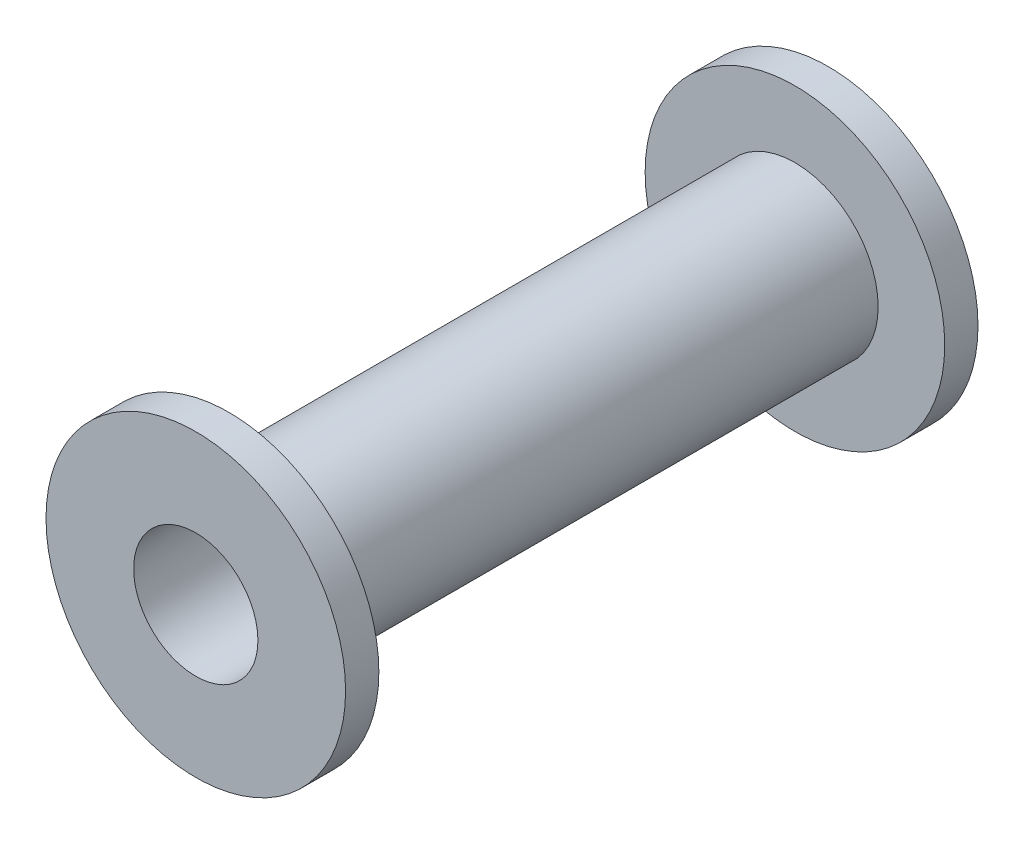
from build123d import *

# Parameters (mm, degrees)
ESBO_O1_R                = 13.5
ESBO_O1_R_2              = 5.6
RESSALTO_EXTRUS_O1_DEPTH = 3
ESBO_O2_R                = 7.5
ESBO_O2_R_2              = 5.6
RESSALTO_EXTRUS_O2_DEPTH = 51
ESBO_O3_R                = 13.5
ESBO_O3_R_2              = 5.6
RESSALTO_EXTRUS_O3_DEPTH = 3


with BuildPart() as part:
    # Esboço1 → Ressalto-extrusão1 (new body)
    with BuildSketch(Plane.XY):
        Circle(ESBO_O1_R)
        Circle(ESBO_O1_R_2, mode=Mode.SUBTRACT)
    extrude(amount=RESSALTO_EXTRUS_O1_DEPTH)

    # Esboço2 → Ressalto-extrusão2 (add)
    with BuildSketch(Plane.XY.offset(3)):
        Circle(ESBO_O2_R)
        Circle(ESBO_O2_R_2, mode=Mode.SUBTRACT)
    extrude(amount=RESSALTO_EXTRUS_O2_DEPTH)

    # Esboço3 → Ressalto-extrusão3 (add)
    with BuildSketch(Plane.XY.offset(54)):
        Circle(ESBO_O3_R)
        Circle(ESBO_O3_R_2, mode=Mode.SUBTRACT)
    extrude(amount=RESSALTO_EXTRUS_O3_DEPTH)


solid = part.part
